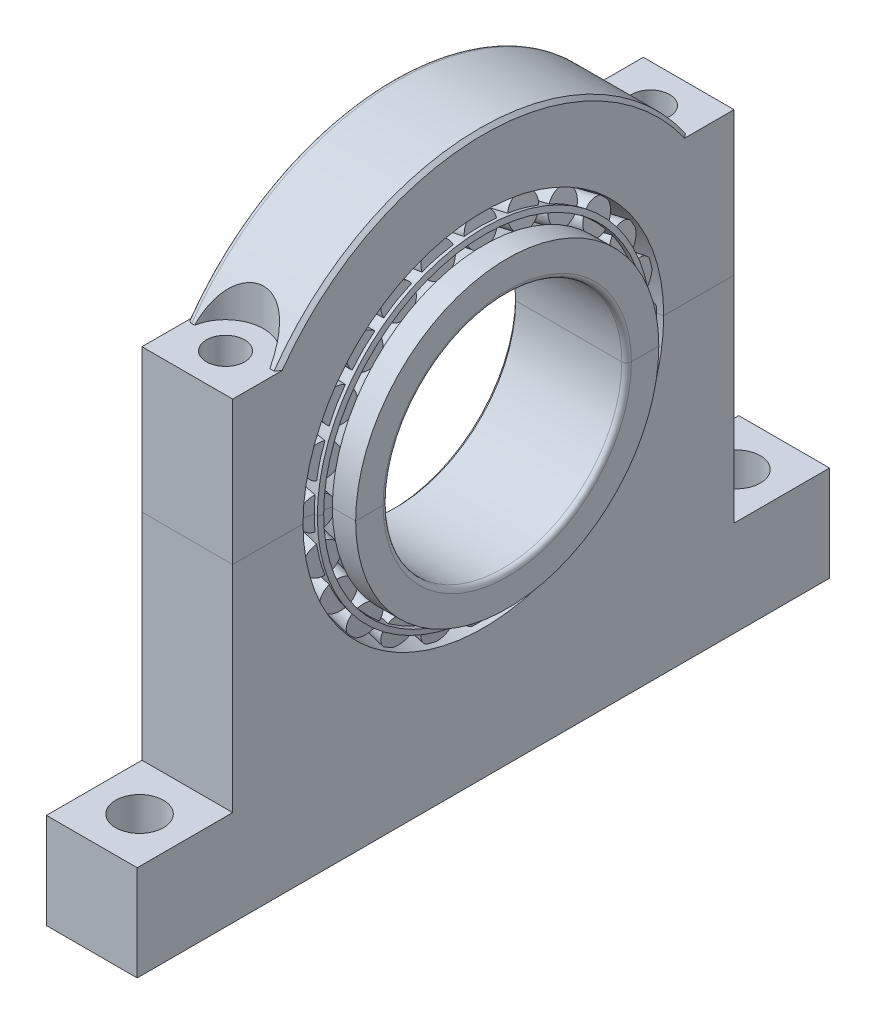
from build123d import *

# Parameters (mm, degrees)
ROLLERSDETAILED_COUNT        = 24
ROLLERSDETAILED_ANGLE        = 345
BOSS_EXTRU_1_DEPTH           = 19
ESQUISSE2_R                  = 8
ENL_V_MAT_EXTRU_1_DEPTH      = 19
ESQUISSE3_R                  = 4
ENL_V_MAT_EXTRU_2_DEPTH      = 60
ESQUISSE4_R                  = 5
ENL_V_MAT_EXTRU_3_DEPTH      = 124.848698113
FRACTIONNER1_SURFACE_1_BACK  = 189.168
FRACTIONNER1_SURFACE_1_DEPTH = 378.336
FRACTIONNER1_SURFACE_2_BACK  = 189.168
FRACTIONNER1_SURFACE_2_DEPTH = 378.336


with BuildPart() as part:
    # OutRacSke → OuterRace (revolve)
    with BuildSketch(Plane.XY, mode=Mode.PRIVATE) as outerrace_sk:
        with BuildLine():
            Line((-5, 37.770363707), (-24, 33.8875))
            Line((-24, 33.8875), (-24, 51.5))
            ThreePointArc((-24, 51.5), (-23.707106781, 52.207106781), (-23, 52.5))
            Line((-23, 52.5), (-5.76, 52.5))
            Line((-5.76, 52.5), (-5, 51.74))
            Line((-5, 51.74), (-5, 37.770363707))
        make_face()
    outerrace = revolve(outerrace_sk.sketch.rotate(Axis((-42.5, 0, 0), (1, 0, 0)), 270), axis=Axis((-42.5, 0, 0), (1, 0, 0)))

    # RolDetSke → RollerDetailed (revolve)
    with BuildSketch(Plane.XY):
        Polygon((-22.324247361, 30.955663122), (-23, 34.262320554), (-6.246269012, 37.686133922), (-5.570516373, 34.379476491), align=None)
    rollerdetailed = revolve(axis=Axis((-44.761406481, 26.370377289, 0), (0.9797503501713442, 0.2002230040208381, 0)))

    # RollersDetailed: OuterRace, RollerDetailed ×24 about axis
    rollersdetailed_axis = Axis((-50, 0, 0), (1, 0, 0))
    add([outerrace.rotate(rollersdetailed_axis, i * ROLLERSDETAILED_ANGLE / (ROLLERSDETAILED_COUNT - 1)) for i in range(1, ROLLERSDETAILED_COUNT)])
    add([rollerdetailed.rotate(rollersdetailed_axis, i * ROLLERSDETAILED_ANGLE / (ROLLERSDETAILED_COUNT - 1)) for i in range(1, ROLLERSDETAILED_COUNT)])

    # InsRacSke → InnerRace (revolve)
    with BuildSketch(Plane.XY, mode=Mode.PRIVATE) as innerrace_sk:
        with BuildLine():
            Line((-21.710709119, 27.98650569), (-24, 27.98650569))
            Line((-24, 27.98650569), (-24, 25.76))
            Line((-24, 25.76), (-23.24, 25))
            Line((-23.24, 25), (-1, 25))
            ThreePointArc((-1, 25), (-0.292893219, 25.292893219), (0, 26))
            Line((0, 26), (0, 31.747819059))
            Line((0, 31.747819059), (-4.88800621, 31.747819059))
            Line((-4.88800621, 31.747819059), (-4.88800621, 31.072819059))
            Line((-4.88800621, 31.072819059), (-21.641737198, 27.64900569))
            Line((-21.641737198, 27.64900569), (-21.710709119, 27.98650569))
        make_face()
    revolve(innerrace_sk.sketch.rotate(Axis((-42.5, 0, 0), (1, 0, 0)), 270), axis=Axis((-42.5, 0, 0), (1, 0, 0)))

    # CagSpiSke → CageSpine (revolve)
    with BuildSketch(Plane.XY, mode=Mode.PRIVATE) as cagespine_sk:
        with BuildLine():
            Line((-4.845455265, 34.931317425), (-22.436872802, 31.336313387))
            ThreePointArc((-22.436872802, 31.336313387), (-23.07894376, 30.902415344), (-23.22614424, 30.141590366))
            Line((-23.22614424, 30.141590366), (-23.045943536, 29.259815051))
            Line((-23.045943536, 29.259815051), (-21.943724392, 29.485065931))
            Line((-21.943724392, 29.485065931), (-22.101400008, 30.256619331))
            Line((-22.101400008, 30.256619331), (-4.620204385, 33.829098281))
            Line((-4.620204385, 33.829098281), (-4.845455265, 34.931317425))
        make_face()
    revolve(cagespine_sk.sketch.rotate(Axis((-42.5, 0, 0), (1, 0, 0)), 90), axis=Axis((-42.5, 0, 0), (1, 0, 0)))

    # Esquisse1 → Boss.-Extru.1 (add)
    with BuildSketch(Plane.ZY.offset(24)):
        with BuildLine():
            Line((-52.5, 30), (-41.859885332, 30))
            ThreePointArc((-41.859885332, 30), (0, -51.5), (41.859885332, 30))
            Line((41.859885332, 30), (52.5, 30))
            Line((52.5, 30), (52.5, -45))
            Line((52.5, -45), (72.5, -45))
            Line((72.5, -45), (72.5, -65))
            Line((72.5, -65), (-72.5, -65))
            Line((-72.5, -65), (-72.5, -45))
            Line((-72.5, -45), (-52.5, -45))
            Line((-52.5, -45), (-52.5, 30))
        make_face()
    extrude(amount=-BOSS_EXTRU_1_DEPTH)

    # Esquisse2 → Enlèv. mat.-Extru.1 (cut)
    with BuildSketch(Plane(origin=(0, 30, 0), x_dir=(1, 0, 0), z_dir=(0, 1, 0))):
        with Locations((-14.5, 44.5)):
            Circle(ESQUISSE2_R)
    enl_v_mat_extru_1 = extrude(amount=ENL_V_MAT_EXTRU_1_DEPTH, mode=Mode.SUBTRACT)

    # Esquisse3 → Enlèv. mat.-Extru.2 (cut)
    with BuildSketch(Plane(origin=(0, 30, 0), x_dir=(1, 0, 0), z_dir=(0, 1, 0))):
        with Locations(Location((-14.5, 44.5, 0), (0, 0, 270))):
            Circle(ESQUISSE3_R)
    enl_v_mat_extru_2 = extrude(amount=-ENL_V_MAT_EXTRU_2_DEPTH, mode=Mode.SUBTRACT)

    # Esquisse4 → Enlèv. mat.-Extru.3 (cut, through all)
    with BuildSketch(Plane(origin=(0, -45, 0), x_dir=(1, 0, 0), z_dir=(0, 1, 0))):
        with Locations(Location((-14.5, 62.5, 0), (0, 0, 270))):
            Circle(ESQUISSE4_R)
    enl_v_mat_extru_3 = extrude(amount=-ENL_V_MAT_EXTRU_3_DEPTH, mode=Mode.SUBTRACT)

    # Symétrie1: Enlèv. mat.-Extru.1, Enlèv. mat.-Extru.2, Enlèv. mat.-Extru.3 across plane
    add(enl_v_mat_extru_1.mirror(Plane.XY), mode=Mode.SUBTRACT)
    add(enl_v_mat_extru_2.mirror(Plane.XY), mode=Mode.SUBTRACT)
    add(enl_v_mat_extru_3.mirror(Plane.XY), mode=Mode.SUBTRACT)


with BuildPart() as body_2:
    # Fractionner1: the piece behind the surface
    add(part.part)
    # Fractionner1 surface: a surface, the sketch's curves swept straight by 378.336 mm
    with BuildLine(Plane.ZY.offset(24).offset(-FRACTIONNER1_SURFACE_1_BACK), mode=Mode.PRIVATE) as fractionner1_surface_1_path:
        Line((-52.5, 0), (52.5, 0))
    fractionner1_surface_1 = Shell.extrude(fractionner1_surface_1_path.wire(), (-1 * FRACTIONNER1_SURFACE_1_DEPTH, 0 * FRACTIONNER1_SURFACE_1_DEPTH, 0 * FRACTIONNER1_SURFACE_1_DEPTH))
    split(bisect_by=fractionner1_surface_1, keep=Keep.BOTTOM)


with BuildPart() as part_1:
    add(part.part)

    # Fractionner1: split by a surface, the side it looks to stays
    # Fractionner1 surface: a surface, the sketch's curves swept straight by 378.336 mm
    with BuildLine(Plane.ZY.offset(24).offset(-FRACTIONNER1_SURFACE_2_BACK), mode=Mode.PRIVATE) as fractionner1_surface_2_path:
        Line((-52.5, 0), (52.5, 0))
    fractionner1_surface_2 = Shell.extrude(fractionner1_surface_2_path.wire(), (-1 * FRACTIONNER1_SURFACE_2_DEPTH, 0 * FRACTIONNER1_SURFACE_2_DEPTH, 0 * FRACTIONNER1_SURFACE_2_DEPTH))
    split(bisect_by=fractionner1_surface_2, keep=Keep.TOP)


solid = Compound([body_2.part, part_1.part])
